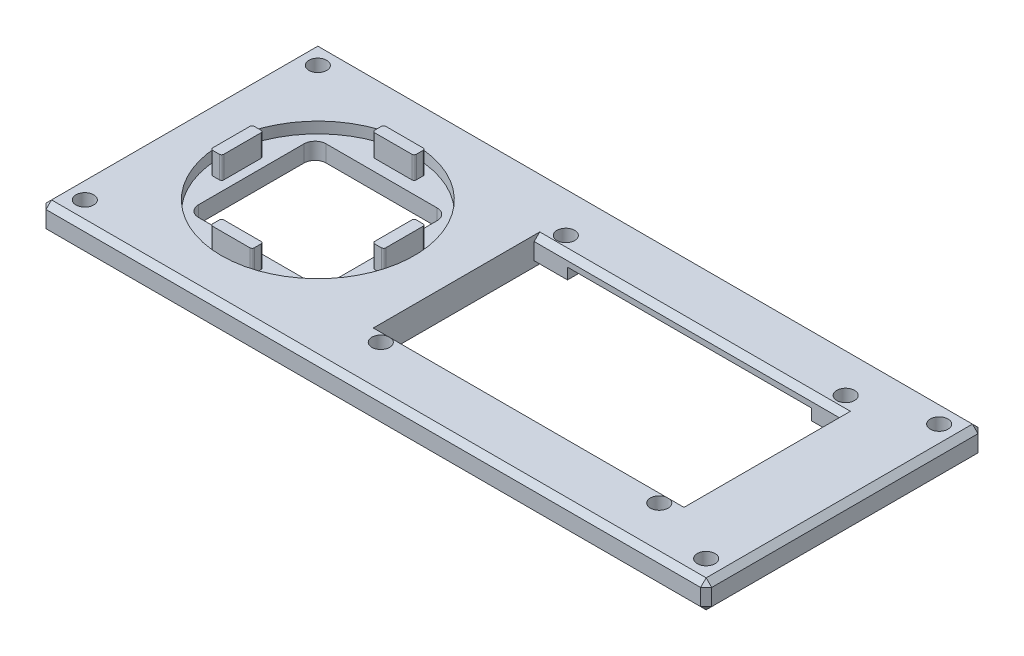
from build123d import *

# Parameters (mm, degrees)
SKETCH1_W           = 120
SKETCH1_H           = 50
BOSS_EXTRUDE1_DEPTH = 5
SKETCH4_R           = 17.4
CUT_EXTRUDE3_DEPTH  = 2
CUT_EXTRUDE2_DEPTH  = 5
BOSS_EXTRUDE2_DEPTH = 4
CIRPATTERN1_COUNT   = 4
SKETCH6_R           = 1.6
CUT_EXTRUDE4_DEPTH  = 131.096118313
SKETCH8_W           = 56
SKETCH8_H           = 28
CUT_EXTRUDE5_DEPTH  = 131.096118313
SKETCH9_W           = 44
SKETCH9_H           = 40
CUT_EXTRUDE6_DEPTH  = 3
SKETCH10_W          = 56
SKETCH10_H          = 40
CUT_EXTRUDE7_DEPTH  = 1
SKETCH11_R          = 1.6
CUT_EXTRUDE8_DEPTH  = 131.096118313
CHAMFER1_SIZE       = 1
CHAMFER2_SIZE       = 1


with BuildPart() as part:
    # Sketch1 → Boss-Extrude1 (new body)
    with BuildSketch(Plane(origin=(0, 0, 0), x_dir=(1, 0, 0), z_dir=(0, 1, 0))):
        with Locations((60, 25)):
            Rectangle(SKETCH1_W, SKETCH1_H)
    extrude(amount=BOSS_EXTRUDE1_DEPTH)

    # Sketch4 → Cut-Extrude3 (cut)
    with BuildSketch(Plane(origin=(0, 5, 0), x_dir=(1, 0, 0), z_dir=(0, 1, 0))):
        with Locations(Location((25, 25, 0), (0, 0, 270))):
            Circle(SKETCH4_R)
    extrude(amount=-CUT_EXTRUDE3_DEPTH, mode=Mode.SUBTRACT)

    # Sketch3 → Cut-Extrude2 (cut)
    with BuildSketch(Plane(origin=(0, 5, 0), x_dir=(1, 0, 0), z_dir=(0, 1, 0))):
        with BuildLine():
            Line((15, 36.5), (35, 36.5))
            ThreePointArc((35, 36.5), (36.414213562, 35.914213562), (37, 34.5))
            Line((37, 34.5), (37, 15.5))
            ThreePointArc((37, 15.5), (36.414213562, 14.085786438), (35, 13.5))
            Line((35, 13.5), (15, 13.5))
            ThreePointArc((15, 13.5), (13.585786438, 14.085786438), (13, 15.5))
            Line((13, 15.5), (13, 34.5))
            ThreePointArc((13, 34.5), (13.585786438, 35.914213562), (15, 36.5))
        make_face()
    extrude(amount=-CUT_EXTRUDE2_DEPTH, mode=Mode.SUBTRACT)

    # Sketch5 → Boss-Extrude2 (add)
    with BuildSketch(Plane(origin=(0, 3, 0), x_dir=(1, 0, 0), z_dir=(0, 1, 0))):
        with BuildLine():
            Line((9.8, 28.75), (11, 28.75))
            ThreePointArc((11, 28.75), (11.282842712, 28.632842712), (11.4, 28.35))
            Line((11.4, 28.35), (11.4, 21.65))
            ThreePointArc((11.4, 21.65), (11.282842712, 21.367157288), (11, 21.25))
            Line((11, 21.25), (9.8, 21.25))
            ThreePointArc((9.8, 21.25), (9.517157288, 21.367157288), (9.4, 21.65))
            Line((9.4, 21.65), (9.4, 28.35))
            ThreePointArc((9.4, 28.35), (9.517157288, 28.632842712), (9.8, 28.75))
        make_face()
    boss_extrude2 = extrude(amount=BOSS_EXTRUDE2_DEPTH)

    # CirPattern1: Boss-Extrude2 ×4 about axis
    cirpattern1_axis = Axis((25, 0, -25), (0, 1, 0))
    for i in range(1, CIRPATTERN1_COUNT):
        add(boss_extrude2.rotate(cirpattern1_axis, i * 360 / CIRPATTERN1_COUNT))

    # Sketch6 → Cut-Extrude4 (cut, through all)
    with BuildSketch(Plane(origin=(0, 5, 0), x_dir=(1, 0, 0), z_dir=(0, 1, 0))):
        with Locations(Location((4, 46, 0), (0, 0, 270))):
            Circle(SKETCH6_R)
        with Locations(Location((116, 46, 0), (0, 0, 270))):
            Circle(SKETCH6_R)
        with Locations(Location((116, 4, 0), (0, 0, 270))):
            Circle(SKETCH6_R)
        with Locations(Location((4, 4, 0), (0, 0, 270))):
            Circle(SKETCH6_R)
    extrude(amount=-CUT_EXTRUDE4_DEPTH, mode=Mode.SUBTRACT)

    # Sketch8 → Cut-Extrude5 (cut, through all)
    with BuildSketch(Plane(origin=(0, 5, 0), x_dir=(1, 0, 0), z_dir=(0, 1, 0))):
        with Locations((78, 25)):
            Rectangle(SKETCH8_W, SKETCH8_H)
    extrude(amount=-CUT_EXTRUDE5_DEPTH, mode=Mode.SUBTRACT)

    # Sketch9 → Cut-Extrude6 (cut)
    with BuildSketch(Plane(origin=(0, 0, 0), x_dir=(1, 0, 0), z_dir=(0, 1, 0))):
        with Locations((78, 25)):
            Rectangle(SKETCH9_W, SKETCH9_H)
    extrude(amount=CUT_EXTRUDE6_DEPTH, mode=Mode.SUBTRACT)

    # Sketch10 → Cut-Extrude7 (cut)
    with BuildSketch(Plane.XZ):
        with Locations((78, -25)):
            Rectangle(SKETCH10_W, SKETCH10_H)
    extrude(amount=-CUT_EXTRUDE7_DEPTH, mode=Mode.SUBTRACT)

    # Sketch11 → Cut-Extrude8 (cut, through all)
    with BuildSketch(Plane(origin=(0, 5, 0), x_dir=(1, 0, 0), z_dir=(0, 1, 0))):
        with Locations(Location((52.9, 41.8, 0), (0, 0, 270))):
            Circle(SKETCH11_R)
        with Locations(Location((103.099401804, 42.045068405, 0), (0, 0, 270))):
            Circle(SKETCH11_R)
        with Locations(Location((103.099812841, 8.445068408, 0), (0, 0, 270))):
            Circle(SKETCH11_R)
        with Locations(Location((52.9, 8.445068408, 0), (0, 0, 270))):
            Circle(SKETCH11_R)
    extrude(amount=-CUT_EXTRUDE8_DEPTH, mode=Mode.SUBTRACT)

    # Chamfer1
    chamfer1_edges = [part.edges().sort_by_distance(p)[0] for p in [
        (120, 5, -25),
        (60, 5, -50),
        (0, 5, -25),
        (60, 0, -50),
        (120, 0, -25),
        (60, 0, 0),
        (0, 0, -25),
        (0, 2.5, -50),
        (120, 2.5, -50),
        (120, 2.5, 0),
        (0, 2.5, 0),
        (60, 5, 0),
    ]]
    chamfer(chamfer1_edges, length=CHAMFER1_SIZE)

    # Chamfer2
    # the kernel refuses this chamfer: 1 mm, written as the material it takes off along each edge
    with BuildSketch(Plane(origin=(106, 5, -11), x_dir=(0, 0.02749587661058651, 0.9996219169112968), z_dir=(-1, 0, 0)), Plane(origin=(50, 5, -39), x_dir=(0, 0.027495876610586414, -0.9996219169112968), z_dir=(1, 0, 0))) as chamfer2_piece_1:
        Polygon((CHAMFER2_SIZE * 0.999621916911, -CHAMFER2_SIZE * 0.0274958766106), (-CHAMFER2_SIZE * 0.0274958766106, -CHAMFER2_SIZE * 0.999621916911), (0, 0), align=None)
    extrude(amount=56, mode=Mode.SUBTRACT)


solid = part.part
